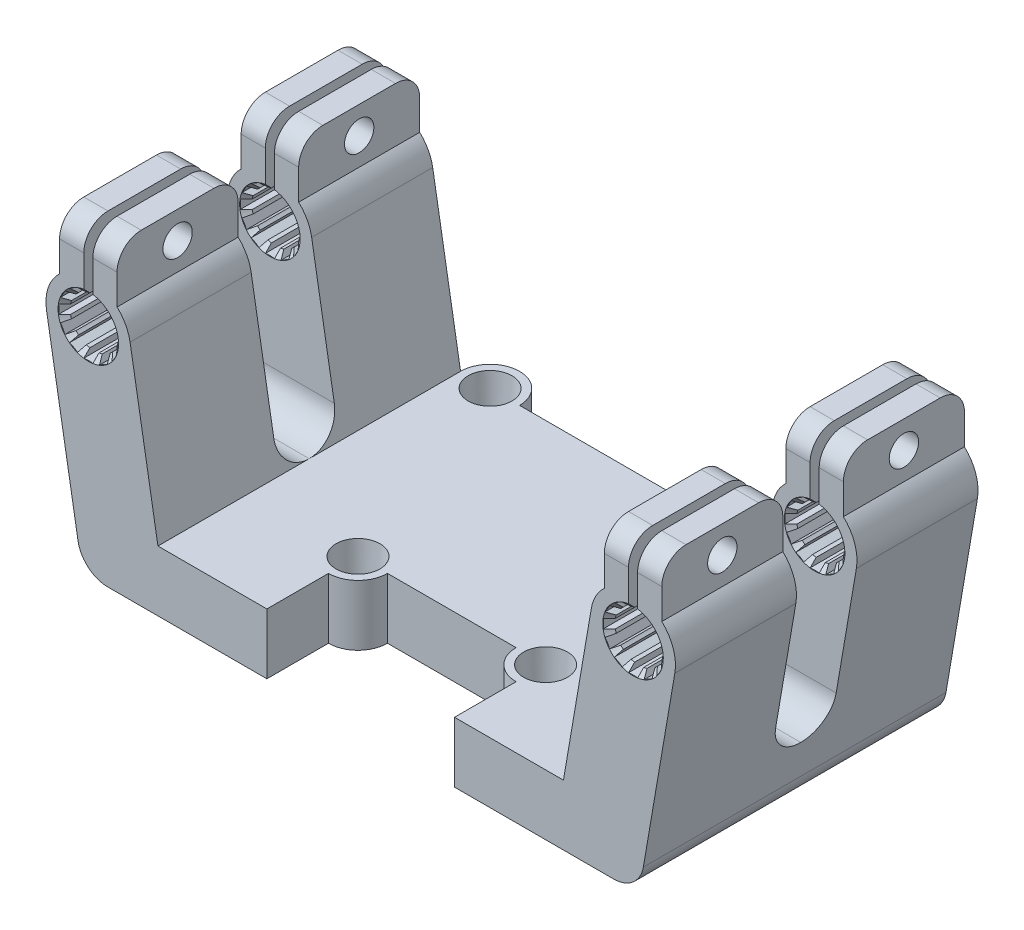
from build123d import *

# Parameters (mm, degrees)
SKETCH1_R                       = 2.125
BOSS_EXTRUDE1_DEPTH             = 10
BOSS_EXTRUDE3_REACH             = 46.442
BOSS_EXTRUDE3_DIRECTION_2_REACH = 46.442
SKETCH6_W                       = 1.5
SKETCH6_H                       = 1
SKETCH6_W_2                     = 1
SKETCH6_H_2                     = 1.5
CUT_EXTRUDE2_DEPTH              = 50
CUT_EXTRUDE3_DEPTH              = 78.064646417
CUT_EXTRUDE3_DEPTH_BACK         = 78.064646417
SKETCH7_W                       = 10
SKETCH7_H                       = 51.995522315
FILLET9_R                       = 5
SKETCH10_R                      = 2.425
CUT_EXTRUDE4_DEPTH              = 117.567672375
FILLET10_R                      = 4


with BuildPart() as part:
    # Sketch1 → Boss-Extrude1 (new body)
    with BuildSketch(Plane(origin=(0, 0, 0), x_dir=(1, 0, 0), z_dir=(0, 1, 0))):
        with BuildLine():
            Line((23.75, 22.5625), (-23.75, 22.5625))
            ThreePointArc((-23.75, 22.5625), (-28.625, 27.4375), (-33.5, 22.5625))
            Line((-33.5, 22.5625), (-33.5, -27.4375))
            Line((-33.5, -27.4375), (-27, -27.4375))
            Line((-27, -27.4375), (-22, -27.4375))
            Line((-22, -27.4375), (-15.5, -27.4375))
            Line((-15.5, -27.4375), (-15.5, -17.2625))
            ThreePointArc((-15.5, -17.2625), (-12.052854442, -15.834645558), (-10.625, -12.3875))
            Line((-10.625, -12.3875), (10.625, -12.3875))
            ThreePointArc((10.625, -12.3875), (12.052854442, -15.834645558), (15.5, -17.2625))
            Line((15.5, -17.2625), (15.5, -27.4375))
            Line((15.5, -27.4375), (22, -27.4375))
            Line((22, -27.4375), (27, -27.4375))
            Line((27, -27.4375), (33.5, -27.4375))
            Line((33.5, -27.4375), (33.5, 22.5625))
            ThreePointArc((33.5, 22.5625), (28.625, 27.4375), (23.75, 22.5625))
        make_face()
        with Locations(Location((-28.625, 22.5625, 0), (0, 0, 270))):
            Circle(SKETCH1_R, mode=Mode.SUBTRACT)
        with Locations(Location((-15.5, -12.3875, 0), (0, 0, 270))):
            Circle(SKETCH1_R, mode=Mode.SUBTRACT)
        with Locations(Location((15.5, -12.3875, 0), (0, 0, 270))):
            Circle(SKETCH1_R, mode=Mode.SUBTRACT)
        with Locations(Location((28.625, 22.5625, 0), (0, 0, 270))):
            Circle(SKETCH1_R, mode=Mode.SUBTRACT)
    extrude(amount=BOSS_EXTRUDE1_DEPTH)

    # Boss-Extrude3: up to this face of the body (flat: up to its plane)
    boss_extrude3_end = Plane(part.part.faces().sort_by_distance((-24.5, 5, 27.4375))[0])
    # Sketch5 → Boss-Extrude3 (add, up to the picked face)
    with BuildSketch(Plane.XY, mode=Mode.PRIVATE) as boss_extrude3_sk1:
        with BuildLine():
            Line((-33.5, 10), (-38.100460774, 36.861048382))
            ThreePointArc((-38.100460774, 36.861048382), (-38.847889029, 39.018763009), (-40.25, 40.821113207))
            Line((-40.25, 40.821113207), (-40.25, 48.821113207))
            Line((-40.25, 48.821113207), (-40.25, 49.821113207))
            Line((-40.25, 49.821113207), (-44.25, 49.821113207))
            Line((-44.25, 49.821113207), (-44.25, 48.821113207))
            Line((-44.25, 48.821113207), (-44.25, 39.608430668))
            ThreePointArc((-44.25, 39.608430668), (-45, 31.679372257), (-45.75, 39.608430668))
            Line((-45.75, 39.608430668), (-45.75, 48.821113207))
            Line((-45.75, 48.821113207), (-45.75, 49.821113207))
            Line((-45.75, 49.821113207), (-49.75, 49.821113207))
            Line((-49.75, 49.821113207), (-49.75, 48.821113207))
            Line((-49.75, 48.821113207), (-49.75, 40.821113207))
            ThreePointArc((-49.75, 40.821113207), (-51.627544185, 37.932294376), (-51.899539226, 34.497696132))
            Line((-51.899539226, 34.497696132), (-45.991158601, 0))
            Line((-45.991158601, 0), (-33.5, 0))
            Line((-33.5, 0), (-33.5, 10))
        make_face()
    boss_extrude3_tool1 = split(extrude(boss_extrude3_sk1.sketch, amount=BOSS_EXTRUDE3_REACH, mode=Mode.PRIVATE), bisect_by=boss_extrude3_end, keep=Keep.BOTH, mode=Mode.PRIVATE)
    boss_extrude3 = boss_extrude3_tool1.solids().sort_by(Axis((-42.520614, 22.095055, 0), (0, 0, 1)))[0]
    add(boss_extrude3)

    # Boss-Extrude3 direction 2: up to this face of the body (flat: up to its plane)
    boss_extrude3_direction_2_end = Plane(part.part.faces().sort_by_distance((0, 5, -22.5625))[0])
    # Sketch5 → Boss-Extrude3 direction 2 (add, up to the picked face)
    with BuildSketch(Plane.XY, mode=Mode.PRIVATE) as boss_extrude3_direction_2_sk1:
        with BuildLine():
            Line((-33.5, 10), (-38.100460774, 36.861048382))
            ThreePointArc((-38.100460774, 36.861048382), (-38.847889029, 39.018763009), (-40.25, 40.821113207))
            Line((-40.25, 40.821113207), (-40.25, 48.821113207))
            Line((-40.25, 48.821113207), (-40.25, 49.821113207))
            Line((-40.25, 49.821113207), (-44.25, 49.821113207))
            Line((-44.25, 49.821113207), (-44.25, 48.821113207))
            Line((-44.25, 48.821113207), (-44.25, 39.608430668))
            ThreePointArc((-44.25, 39.608430668), (-45, 31.679372257), (-45.75, 39.608430668))
            Line((-45.75, 39.608430668), (-45.75, 48.821113207))
            Line((-45.75, 48.821113207), (-45.75, 49.821113207))
            Line((-45.75, 49.821113207), (-49.75, 49.821113207))
            Line((-49.75, 49.821113207), (-49.75, 48.821113207))
            Line((-49.75, 48.821113207), (-49.75, 40.821113207))
            ThreePointArc((-49.75, 40.821113207), (-51.627544185, 37.932294376), (-51.899539226, 34.497696132))
            Line((-51.899539226, 34.497696132), (-45.991158601, 0))
            Line((-45.991158601, 0), (-33.5, 0))
            Line((-33.5, 0), (-33.5, 10))
        make_face()
    boss_extrude3_direction_2_tool1 = split(extrude(boss_extrude3_direction_2_sk1.sketch, amount=-BOSS_EXTRUDE3_DIRECTION_2_REACH, mode=Mode.PRIVATE), bisect_by=boss_extrude3_direction_2_end, keep=Keep.BOTH, mode=Mode.PRIVATE)
    boss_extrude3_direction_2 = boss_extrude3_direction_2_tool1.solids().sort_by(Axis((-42.520614, 22.095055, 0), (0, 0, -1)))[0]
    add(boss_extrude3_direction_2)

    # Mirror2: Boss-Extrude3, Boss-Extrude3 direction 2 across plane
    add(boss_extrude3.mirror(Plane(origin=(0, 0, 0), x_dir=(0, 0, 1), z_dir=(1, 0, 0))))
    add(boss_extrude3_direction_2.mirror(Plane(origin=(0, 0, 0), x_dir=(0, 0, 1), z_dir=(1, 0, 0))))

    # Sketch6 → Cut-Extrude2 (cut)
    with BuildSketch(Plane.XY.offset(27.4375)):
        with Locations((-45, 40.108430668)):
            Rectangle(SKETCH6_W, SKETCH6_H)
        Polygon((-43.184989847, 40.323062058), (-43.684989847, 39.457036654), (-42.385951741, 38.707036654), (-41.885951741, 39.573062058), align=None)
        Polygon((-41.106310199, 38.793420515), (-41.972335603, 38.293420515), (-41.222335603, 36.994382409), (-40.356310199, 37.494382409), align=None)
        with Locations((-40.570941589, 35.679372257)):
            Rectangle(SKETCH6_W_2, SKETCH6_H_2)
        Polygon((-40.356310199, 33.864362104), (-41.222335603, 34.364362104), (-41.972335603, 33.065323998), (-41.106310199, 32.565323998), align=None)
        Polygon((-41.885951741, 31.785682456), (-42.385951741, 32.651707859), (-43.684989847, 31.901707859), (-43.184989847, 31.035682456), align=None)
        with Locations((-45, 31.250313845)):
            Rectangle(SKETCH6_W, SKETCH6_H)
        Polygon((-46.815010153, 31.035682456), (-46.315010153, 31.901707859), (-47.614048259, 32.651707859), (-48.114048259, 31.785682456), align=None)
        Polygon((-48.893689801, 32.565323998), (-48.027664397, 33.065323998), (-48.777664397, 34.364362104), (-49.643689801, 33.864362104), align=None)
        with Locations((-49.429058411, 35.679372257)):
            Rectangle(SKETCH6_W_2, SKETCH6_H_2)
        Polygon((-49.643689801, 37.494382409), (-48.777664397, 36.994382409), (-48.027664397, 38.293420515), (-48.893689801, 38.793420515), align=None)
        Polygon((-48.114048259, 39.573062058), (-47.614048259, 38.707036654), (-46.315010153, 39.457036654), (-46.815010153, 40.323062058), align=None)
    cut_extrude2 = extrude(amount=-CUT_EXTRUDE2_DEPTH, mode=Mode.SUBTRACT)

    # Mirror3: Cut-Extrude2 across plane
    add(cut_extrude2.mirror(Plane(origin=(0, 0, 0), x_dir=(0, 0, 1), z_dir=(1, 0, 0))), mode=Mode.SUBTRACT)

    # Sketch7 → Cut-Extrude3 (cut, two sides: drawn at the far end of the back side and taken through both)
    with BuildSketch(Plane(origin=(0, 0, 0), x_dir=(0, 0, -1), z_dir=(1, 0, 0)).offset(-CUT_EXTRUDE3_DEPTH_BACK)):
        with Locations((-2.4375, 35.997761158)):
            Rectangle(SKETCH7_W, SKETCH7_H)
    extrude(amount=CUT_EXTRUDE3_DEPTH + CUT_EXTRUDE3_DEPTH_BACK, mode=Mode.SUBTRACT)

    # Fillet9
    fillet9_edges = [part.edges().sort_by_distance(p)[0] for p in [
        (-45.991158601, 0, 2.4375),
        (45.991158601, 0, 2.4375),
        (40.601923533, 10, 7.4375),
        (40.601923533, 10, -2.5625),
        (-40.601923533, 10, 7.4375),
        (-40.601923533, 10, -2.5625),
    ]]
    fillet(fillet9_edges, radius=FILLET9_R - 0.0001)  # a hair under: the kernel refuses the full size

    # Chamfer4: read off the stored shape, not the designer's step
    # Chamfer4: loft between two sections, ruled curve by curve
    chamfer4_from = [
        Edge.make_three_point_arc((44.4, 39.634116243, 26.4375), (41.01133005, 35.378520089, 26.4375), (45, 31.679372257, 26.4375)),
        Edge.make_three_point_arc((45, 31.679372257, 26.4375), (48.98866995, 35.378520089, 26.4375), (45.6, 39.634116243, 26.4375)),
        Edge.make_line((45.6, 39.634116243, 26.4375), (44.4, 39.634116243, 26.4375)),
    ]
    chamfer4_to = [
        Edge.make_three_point_arc((44.25, 40.62280224, 27.4375), (40.014162562, 35.303307047, 27.4375), (45, 30.679372257, 27.4375)),
        Edge.make_three_point_arc((45, 30.679372257, 27.4375), (49.985837438, 35.303307047, 27.4375), (45.75, 40.62280224, 27.4375)),
        Edge.make_line((45.75, 40.62280224, 27.4375), (44.25, 40.62280224, 27.4375)),
    ]
    chamfer4 = Solid(Shell([*[Face.make_surface_from_curves(chamfer4_from[k], chamfer4_to[k]) for k in range(3)], Face(Wire(chamfer4_from)), Face(Wire(chamfer4_to))]))
    add(chamfer4, mode=Mode.SUBTRACT)

    # Chamfer4 2: loft between two sections, ruled curve by curve
    chamfer4_2_from = [
        Edge.make_three_point_arc((-45.6, 39.634116243, 26.4375), (-48.98866995, 35.378520089, 26.4375), (-45, 31.679372257, 26.4375)),
        Edge.make_three_point_arc((-45, 31.679372257, 26.4375), (-41.01133005, 35.378520089, 26.4375), (-44.4, 39.634116243, 26.4375)),
        Edge.make_line((-44.4, 39.634116243, 26.4375), (-45.6, 39.634116243, 26.4375)),
    ]
    chamfer4_2_to = [
        Edge.make_three_point_arc((-45.75, 40.62280224, 27.4375), (-49.985837438, 35.303307047, 27.4375), (-45, 30.679372257, 27.4375)),
        Edge.make_three_point_arc((-45, 30.679372257, 27.4375), (-40.014162562, 35.303307047, 27.4375), (-44.25, 40.62280224, 27.4375)),
        Edge.make_line((-44.25, 40.62280224, 27.4375), (-45.75, 40.62280224, 27.4375)),
    ]
    chamfer4_2 = Solid(Shell([*[Face.make_surface_from_curves(chamfer4_2_from[k], chamfer4_2_to[k]) for k in range(3)], Face(Wire(chamfer4_2_from)), Face(Wire(chamfer4_2_to))]))
    add(chamfer4_2, mode=Mode.SUBTRACT)

    # Chamfer4 3: loft between two sections, ruled curve by curve
    chamfer4_3_from = [
        Edge.make_three_point_arc((44.4, 39.634116243, -3.5625), (41.01133005, 35.378520089, -3.5625), (45, 31.679372257, -3.5625)),
        Edge.make_three_point_arc((45, 31.679372257, -3.5625), (48.98866995, 35.378520089, -3.5625), (45.6, 39.634116243, -3.5625)),
        Edge.make_line((45.6, 39.634116243, -3.5625), (44.4, 39.634116243, -3.5625)),
    ]
    chamfer4_3_to = [
        Edge.make_three_point_arc((44.25, 40.62280224, -2.5625), (40.014162562, 35.303307047, -2.5625), (45, 30.679372257, -2.5625)),
        Edge.make_three_point_arc((45, 30.679372257, -2.5625), (49.985837438, 35.303307047, -2.5625), (45.75, 40.62280224, -2.5625)),
        Edge.make_line((45.75, 40.62280224, -2.5625), (44.25, 40.62280224, -2.5625)),
    ]
    chamfer4_3 = Solid(Shell([*[Face.make_surface_from_curves(chamfer4_3_from[k], chamfer4_3_to[k]) for k in range(3)], Face(Wire(chamfer4_3_from)), Face(Wire(chamfer4_3_to))]))
    add(chamfer4_3, mode=Mode.SUBTRACT)

    # Chamfer4 4: loft between two sections, ruled curve by curve
    chamfer4_4_from = [
        Edge.make_three_point_arc((45.6, 39.634116243, -21.5625), (48.98866995, 35.378520089, -21.5625), (45, 31.679372257, -21.5625)),
        Edge.make_three_point_arc((45, 31.679372257, -21.5625), (41.01133005, 35.378520089, -21.5625), (44.4, 39.634116243, -21.5625)),
        Edge.make_line((44.4, 39.634116243, -21.5625), (45.6, 39.634116243, -21.5625)),
    ]
    chamfer4_4_to = [
        Edge.make_three_point_arc((45.75, 40.62280224, -22.5625), (49.985837438, 35.303307047, -22.5625), (45, 30.679372257, -22.5625)),
        Edge.make_three_point_arc((45, 30.679372257, -22.5625), (40.014162562, 35.303307047, -22.5625), (44.25, 40.62280224, -22.5625)),
        Edge.make_line((44.25, 40.62280224, -22.5625), (45.75, 40.62280224, -22.5625)),
    ]
    chamfer4_4 = Solid(Shell([*[Face.make_surface_from_curves(chamfer4_4_from[k], chamfer4_4_to[k]) for k in range(3)], Face(Wire(chamfer4_4_from)), Face(Wire(chamfer4_4_to))]))
    add(chamfer4_4, mode=Mode.SUBTRACT)

    # Chamfer4 5: loft between two sections, ruled curve by curve
    chamfer4_5_from = [
        Edge.make_three_point_arc((45.6, 39.634116243, 8.4375), (48.98866995, 35.378520089, 8.4375), (45, 31.679372257, 8.4375)),
        Edge.make_three_point_arc((45, 31.679372257, 8.4375), (41.01133005, 35.378520089, 8.4375), (44.4, 39.634116243, 8.4375)),
        Edge.make_line((44.4, 39.634116243, 8.4375), (45.6, 39.634116243, 8.4375)),
    ]
    chamfer4_5_to = [
        Edge.make_three_point_arc((45.75, 40.62280224, 7.4375), (49.985837438, 35.303307047, 7.4375), (45, 30.679372257, 7.4375)),
        Edge.make_three_point_arc((45, 30.679372257, 7.4375), (40.014162562, 35.303307047, 7.4375), (44.25, 40.62280224, 7.4375)),
        Edge.make_line((44.25, 40.62280224, 7.4375), (45.75, 40.62280224, 7.4375)),
    ]
    chamfer4_5 = Solid(Shell([*[Face.make_surface_from_curves(chamfer4_5_from[k], chamfer4_5_to[k]) for k in range(3)], Face(Wire(chamfer4_5_from)), Face(Wire(chamfer4_5_to))]))
    add(chamfer4_5, mode=Mode.SUBTRACT)

    # Chamfer4 6: loft between two sections, ruled curve by curve
    chamfer4_6_from = [
        Edge.make_three_point_arc((-45.6, 39.634116243, -3.5625), (-48.98866995, 35.378520089, -3.5625), (-45, 31.679372257, -3.5625)),
        Edge.make_three_point_arc((-45, 31.679372257, -3.5625), (-41.01133005, 35.378520089, -3.5625), (-44.4, 39.634116243, -3.5625)),
        Edge.make_line((-44.4, 39.634116243, -3.5625), (-45.6, 39.634116243, -3.5625)),
    ]
    chamfer4_6_to = [
        Edge.make_three_point_arc((-45.75, 40.62280224, -2.5625), (-49.985837438, 35.303307047, -2.5625), (-45, 30.679372257, -2.5625)),
        Edge.make_three_point_arc((-45, 30.679372257, -2.5625), (-40.014162562, 35.303307047, -2.5625), (-44.25, 40.62280224, -2.5625)),
        Edge.make_line((-44.25, 40.62280224, -2.5625), (-45.75, 40.62280224, -2.5625)),
    ]
    chamfer4_6 = Solid(Shell([*[Face.make_surface_from_curves(chamfer4_6_from[k], chamfer4_6_to[k]) for k in range(3)], Face(Wire(chamfer4_6_from)), Face(Wire(chamfer4_6_to))]))
    add(chamfer4_6, mode=Mode.SUBTRACT)

    # Chamfer4 7: loft between two sections, ruled curve by curve
    chamfer4_7_from = [
        Edge.make_three_point_arc((-44.4, 39.634116243, 8.4375), (-41.01133005, 35.378520089, 8.4375), (-45, 31.679372257, 8.4375)),
        Edge.make_three_point_arc((-45, 31.679372257, 8.4375), (-48.98866995, 35.378520089, 8.4375), (-45.6, 39.634116243, 8.4375)),
        Edge.make_line((-45.6, 39.634116243, 8.4375), (-44.4, 39.634116243, 8.4375)),
    ]
    chamfer4_7_to = [
        Edge.make_three_point_arc((-44.25, 40.62280224, 7.4375), (-40.014162562, 35.303307047, 7.4375), (-45, 30.679372257, 7.4375)),
        Edge.make_three_point_arc((-45, 30.679372257, 7.4375), (-49.985837438, 35.303307047, 7.4375), (-45.75, 40.62280224, 7.4375)),
        Edge.make_line((-45.75, 40.62280224, 7.4375), (-44.25, 40.62280224, 7.4375)),
    ]
    chamfer4_7 = Solid(Shell([*[Face.make_surface_from_curves(chamfer4_7_from[k], chamfer4_7_to[k]) for k in range(3)], Face(Wire(chamfer4_7_from)), Face(Wire(chamfer4_7_to))]))
    add(chamfer4_7, mode=Mode.SUBTRACT)

    # Chamfer4 8: loft between two sections, ruled curve by curve
    chamfer4_8_from = [
        Edge.make_three_point_arc((-44.4, 39.634116243, -21.5625), (-41.01133005, 35.378520089, -21.5625), (-45, 31.679372257, -21.5625)),
        Edge.make_three_point_arc((-45, 31.679372257, -21.5625), (-48.98866995, 35.378520089, -21.5625), (-45.6, 39.634116243, -21.5625)),
        Edge.make_line((-45.6, 39.634116243, -21.5625), (-44.4, 39.634116243, -21.5625)),
    ]
    chamfer4_8_to = [
        Edge.make_three_point_arc((-44.25, 40.62280224, -22.5625), (-40.014162562, 35.303307047, -22.5625), (-45, 30.679372257, -22.5625)),
        Edge.make_three_point_arc((-45, 30.679372257, -22.5625), (-49.985837438, 35.303307047, -22.5625), (-45.75, 40.62280224, -22.5625)),
        Edge.make_line((-45.75, 40.62280224, -22.5625), (-44.25, 40.62280224, -22.5625)),
    ]
    chamfer4_8 = Solid(Shell([*[Face.make_surface_from_curves(chamfer4_8_from[k], chamfer4_8_to[k]) for k in range(3)], Face(Wire(chamfer4_8_from)), Face(Wire(chamfer4_8_to))]))
    add(chamfer4_8, mode=Mode.SUBTRACT)

    # Sketch10 → Cut-Extrude4 (cut, through all)
    with BuildSketch(Plane.ZY.offset(49.75)):
        with Locations((-12.5625, 45.321113207)):
            Circle(SKETCH10_R)
        with Locations((17.4375, 45.321113207)):
            Circle(SKETCH10_R)
    extrude(amount=-CUT_EXTRUDE4_DEPTH, mode=Mode.SUBTRACT)

    # Fillet10
    fillet10_edges = [part.edges().sort_by_distance(p)[0] for p in [
        (-42.25, 49.821113207, 27.4375),
        (-47.75, 49.821113207, -2.5625),
        (-42.25, 49.821113207, -2.5625),
        (47.75, 49.821113207, -2.5625),
        (42.25, 49.821113207, -2.5625),
        (-42.25, 49.821113207, 7.4375),
        (-47.75, 49.821113207, 7.4375),
        (-47.75, 49.821113207, 27.4375),
        (42.25, 49.821113207, 7.4375),
        (-42.25, 49.821113207, -22.5625),
        (47.75, 49.821113207, 7.4375),
        (-47.75, 49.821113207, -22.5625),
        (42.25, 49.821113207, -22.5625),
        (47.75, 49.821113207, -22.5625),
        (42.25, 49.821113207, 27.4375),
        (47.75, 49.821113207, 27.4375),
    ]]
    fillet(fillet10_edges, radius=FILLET10_R)

    # M5_Cut: read off the stored shape, not the designer's step
    # M5_Cut: loft between two sections, ruled curve by curve
    m5_cut_from = [
        Edge.make_three_point_arc((-15.5, 0, 15.1375), (-12.75, 0, 12.3875), (-15.5, 0, 9.6375)),
        Edge.make_three_point_arc((-15.5, 0, 9.6375), (-18.25, 0, 12.3875), (-15.5, 0, 15.1375)),
    ]
    m5_cut_to = [
        Edge.make_three_point_arc((-15.5, 10, 16.012386635), (-11.875113365, 10, 12.3875), (-15.5, 10, 8.762613365)),
        Edge.make_three_point_arc((-15.5, 10, 8.762613365), (-19.124886635, 10, 12.3875), (-15.5, 10, 16.012386635)),
    ]
    m5_cut = Solid(Shell([*[Face.make_surface_from_curves(m5_cut_from[k], m5_cut_to[k]) for k in range(2)], Face(Wire(m5_cut_from)), Face(Wire(m5_cut_to))]))
    add(m5_cut, mode=Mode.SUBTRACT)

    # M5_Cut 2: loft between two sections, ruled curve by curve
    m5_cut_2_from = [
        Edge.make_three_point_arc((-28.625, 0, -19.8125), (-25.875, 0, -22.5625), (-28.625, 0, -25.3125)),
        Edge.make_three_point_arc((-28.625, 0, -25.3125), (-31.375, 0, -22.5625), (-28.625, 0, -19.8125)),
    ]
    m5_cut_2_to = [
        Edge.make_three_point_arc((-28.625, 10, -18.937613365), (-25.000113365, 10, -22.5625), (-28.625, 10, -26.187386635)),
        Edge.make_three_point_arc((-28.625, 10, -26.187386635), (-32.249886635, 10, -22.5625), (-28.625, 10, -18.937613365)),
    ]
    m5_cut_2 = Solid(Shell([*[Face.make_surface_from_curves(m5_cut_2_from[k], m5_cut_2_to[k]) for k in range(2)], Face(Wire(m5_cut_2_from)), Face(Wire(m5_cut_2_to))]))
    add(m5_cut_2, mode=Mode.SUBTRACT)

    # M5_Cut 3: loft between two sections, ruled curve by curve
    m5_cut_3_from = [
        Edge.make_three_point_arc((28.625, 0, -19.8125), (31.375, 0, -22.5625), (28.625, 0, -25.3125)),
        Edge.make_three_point_arc((28.625, 0, -25.3125), (25.875, 0, -22.5625), (28.625, 0, -19.8125)),
    ]
    m5_cut_3_to = [
        Edge.make_three_point_arc((28.625, 10, -18.937613365), (32.249886635, 10, -22.5625), (28.625, 10, -26.187386635)),
        Edge.make_three_point_arc((28.625, 10, -26.187386635), (25.000113365, 10, -22.5625), (28.625, 10, -18.937613365)),
    ]
    m5_cut_3 = Solid(Shell([*[Face.make_surface_from_curves(m5_cut_3_from[k], m5_cut_3_to[k]) for k in range(2)], Face(Wire(m5_cut_3_from)), Face(Wire(m5_cut_3_to))]))
    add(m5_cut_3, mode=Mode.SUBTRACT)

    # M5_Cut 4: loft between two sections, ruled curve by curve
    m5_cut_4_from = [
        Edge.make_three_point_arc((15.5, 0, 15.1375), (18.25, 0, 12.3875), (15.5, 0, 9.6375)),
        Edge.make_three_point_arc((15.5, 0, 9.6375), (12.75, 0, 12.3875), (15.5, 0, 15.1375)),
    ]
    m5_cut_4_to = [
        Edge.make_three_point_arc((15.5, 10, 16.012386635), (19.124886635, 10, 12.3875), (15.5, 10, 8.762613365)),
        Edge.make_three_point_arc((15.5, 10, 8.762613365), (11.875113365, 10, 12.3875), (15.5, 10, 16.012386635)),
    ]
    m5_cut_4 = Solid(Shell([*[Face.make_surface_from_curves(m5_cut_4_from[k], m5_cut_4_to[k]) for k in range(2)], Face(Wire(m5_cut_4_from)), Face(Wire(m5_cut_4_to))]))
    add(m5_cut_4, mode=Mode.SUBTRACT)


solid = part.part
